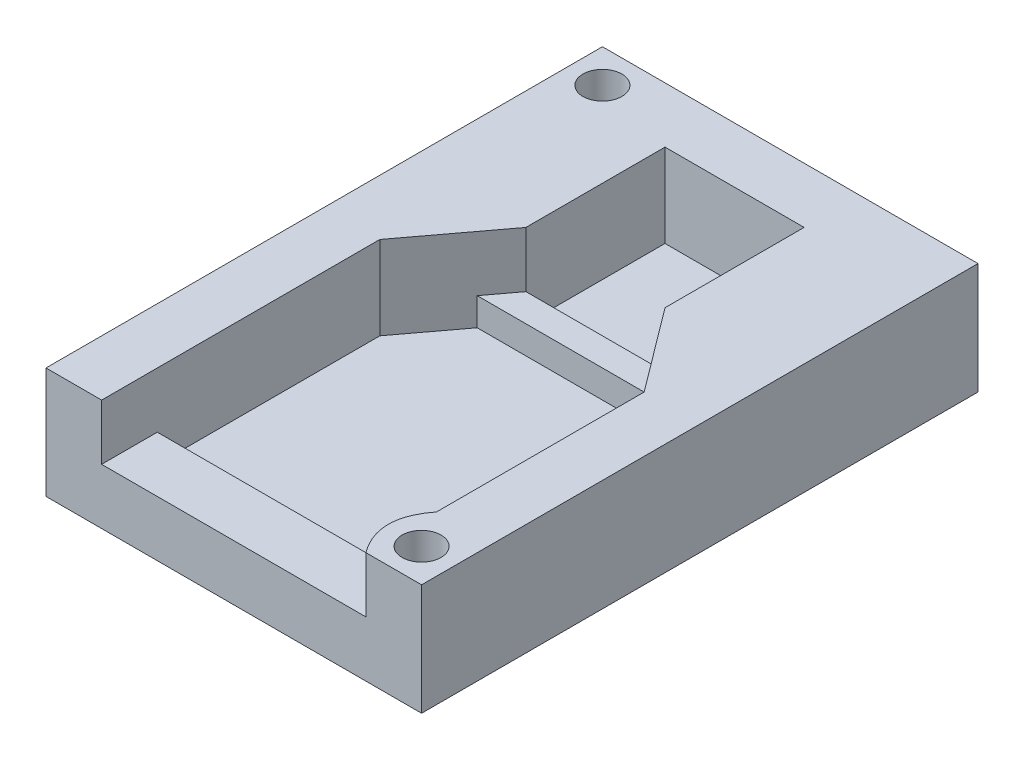
from build123d import *

# Parameters (mm, degrees)
SKETCH1_W           = 13.5
SKETCH1_H           = 20
BOSS_EXTRUDE1_DEPTH = 1
BOSS_EXTRUDE2_DEPTH = 3
BOSS_EXTRUDE3_DEPTH = 1
CUT_EXTRUDE1_START  = -1
SKETCH4_R           = 0.7
CUT_EXTRUDE1_DEPTH  = 11.5
SKETCH5_W           = 9.5
SKETCH5_H           = 2
BOSS_EXTRUDE4_DEPTH = 1


with BuildPart() as part:
    # Sketch1 → Boss-Extrude1 (new body)
    with BuildSketch(Plane(origin=(0, 0, 0), x_dir=(1, 0, 0), z_dir=(0, 1, 0))):
        with Locations((6.75, 10)):
            Rectangle(SKETCH1_W, SKETCH1_H)
    extrude(amount=BOSS_EXTRUDE1_DEPTH)

    # Sketch2 → Boss-Extrude2 (add)
    with BuildSketch(Plane(origin=(0, 1, 0), x_dir=(1, 0, 0), z_dir=(0, 1, 0))):
        with BuildLine():
            Line((2, 10), (2, 2))
            Line((2, 2), (2, 0))
            Line((2, 0), (0, 0))
            Line((0, 0), (0, 20))
            Line((0, 20), (13.5, 20))
            Line((13.5, 20), (13.5, 0))
            Line((13.5, 0), (11.5, 0))
            add(Edge.make_bspline(
                [(11.5, 2.535585729), (10.536627545, 1.300187459), (11.5, 0)],
                knots=[0, 0, 0, 1, 1, 1], degree=2))
            Line((11.5, 2.535585729), (11.5, 10))
            Line((11.5, 10), (9.25, 13))
            Line((9.25, 13), (9.25, 18))
            Line((9.25, 18), (4.25, 18))
            Line((4.25, 18), (4.25, 13))
            Line((4.25, 13), (2, 10))
        make_face()
    extrude(amount=BOSS_EXTRUDE2_DEPTH)

    # Sketch3 → Boss-Extrude3 (add)
    with BuildSketch(Plane(origin=(0, 1, 0), x_dir=(1, 0, 0), z_dir=(0, 1, 0))):
        Polygon((4.25, 13), (9.25, 13), (10, 12), (3.5, 12), align=None)
    extrude(amount=BOSS_EXTRUDE3_DEPTH)

    # Sketch4 → Cut-Extrude1 (cut)
    with BuildSketch(Plane.XZ.offset(CUT_EXTRUDE1_START)):
        with Locations((1.2, -18.8)):
            Circle(SKETCH4_R)
        with Locations((12.3, -1.2)):
            Circle(SKETCH4_R)
    extrude(amount=-CUT_EXTRUDE1_DEPTH, mode=Mode.SUBTRACT)

    # Sketch5 → Boss-Extrude4 (add)
    with BuildSketch(Plane(origin=(0, 1, 0), x_dir=(1, 0, 0), z_dir=(0, 1, 0))):
        with Locations((6.75, 1)):
            Rectangle(SKETCH5_W, SKETCH5_H)
    extrude(amount=BOSS_EXTRUDE4_DEPTH)


solid = part.part
